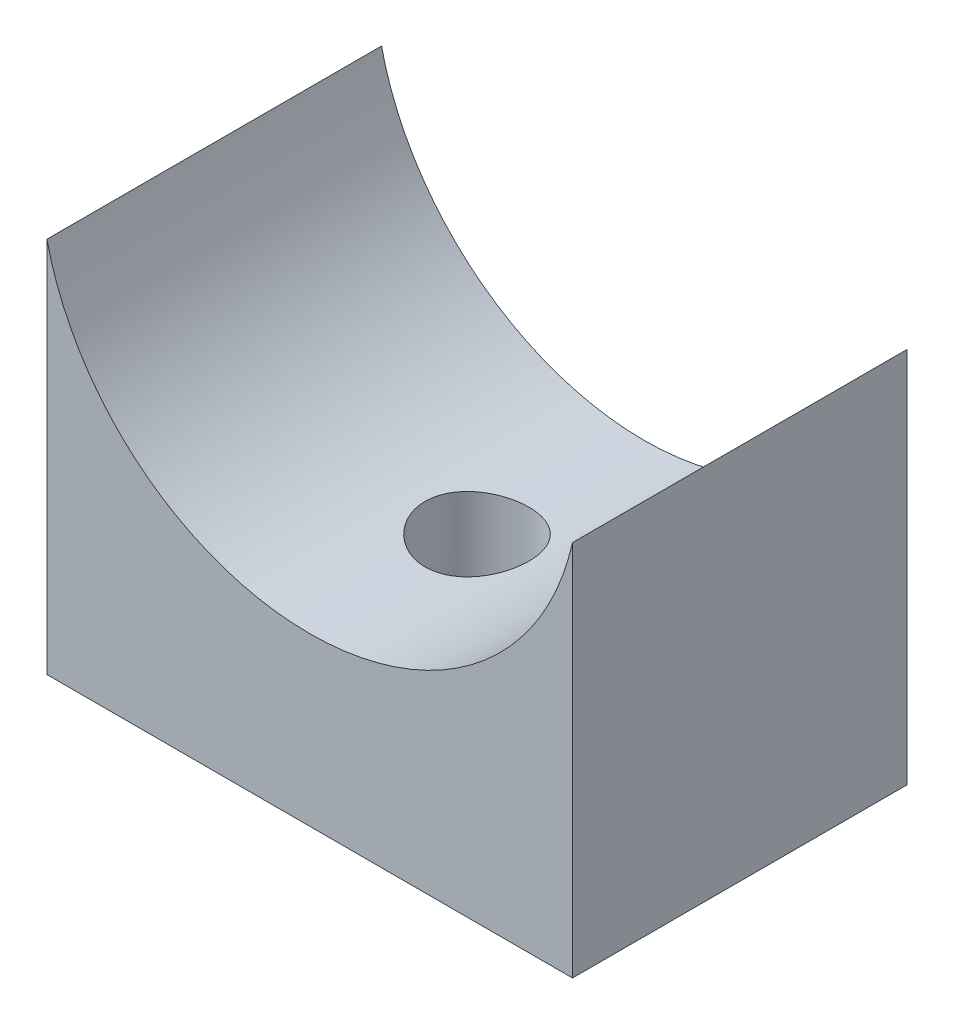
from build123d import *

# Parameters (mm, degrees)
BOSS_EXTRUDE1_DEPTH     = 5
CUT_EXTRUDE1_REACH      = 16.618
CUT_EXTRUDE1_END_RADIUS = 8.05
SKETCH2_R               = 1.55


with BuildPart() as part:
    # Sketch1 → Boss-Extrude1 (new, symmetric)
    with BuildSketch(Plane.XY):
        with BuildLine():
            Line((-7.853916499, -11.27), (7.853916499, -11.27))
            Line((7.853916499, -11.27), (7.853916499, 0))
            ThreePointArc((7.853916499, 0), (0, -6.284073719), (-7.853916499, 0))
            Line((-7.853916499, 0), (-7.853916499, -11.27))
        make_face()
    extrude(amount=BOSS_EXTRUDE1_DEPTH, both=True)

    # Cut-Extrude1: up to this cylinder (the profile starts outside it)
    cut_extrude1_end = Plane(origin=(0, 1.765926281, 0), z_dir=(0, 0, -1)) * Cylinder(CUT_EXTRUDE1_END_RADIUS, 50.336, mode=Mode.PRIVATE)
    # Sketch2 → Cut-Extrude1 (cut, up to the surface)
    with BuildSketch(Plane(origin=(0, -11.27, 0), x_dir=(-1, 0, 0), z_dir=(0, -1, 0)), mode=Mode.PRIVATE) as cut_extrude1_sk1:
        Circle(SKETCH2_R)
    cut_extrude1_tool1 = extrude(cut_extrude1_sk1.sketch, amount=-CUT_EXTRUDE1_REACH, mode=Mode.PRIVATE) - cut_extrude1_end
    add(cut_extrude1_tool1.solids().sort_by_distance((0, -11.27, 0))[0], mode=Mode.SUBTRACT)


solid = part.part
